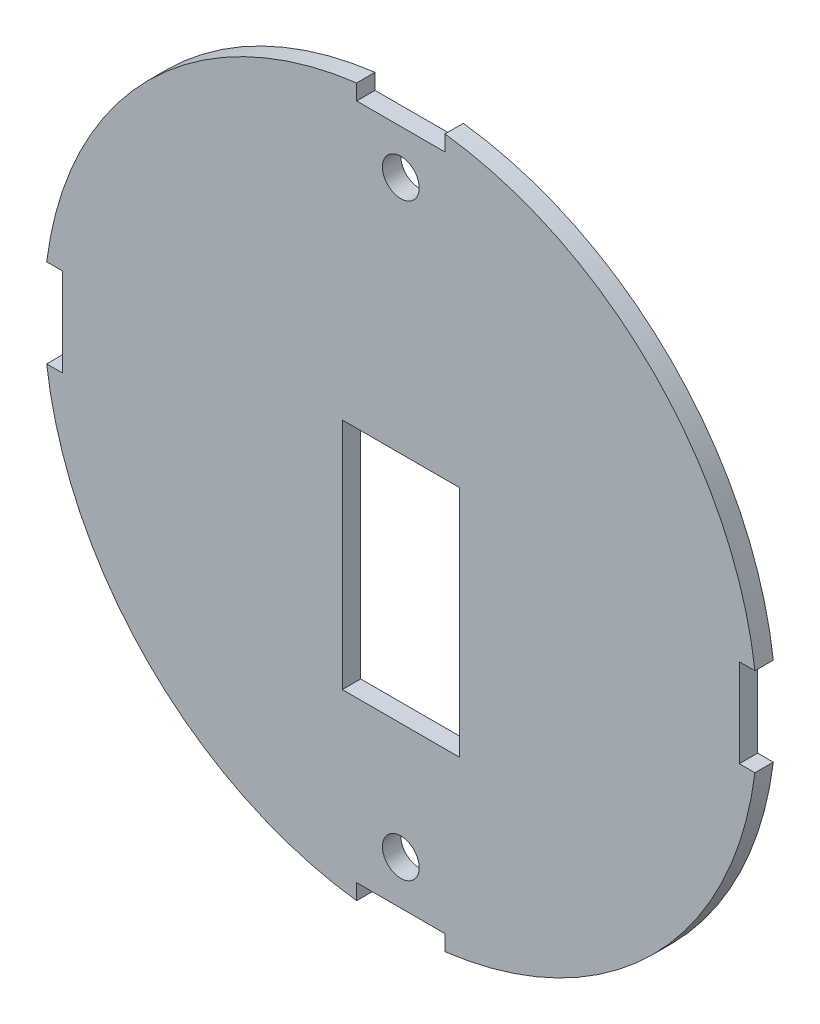
from build123d import *

# Parameters (mm, degrees)
SKETCH1_R           = 61.595
BOSS_EXTRUDE1_DEPTH = 3.175
SKETCH2_R           = 3.175
SKETCH2_W           = 15.24
SKETCH2_H           = 6.35
CUT_EXTRUDE1_DEPTH  = 3.175
CIRPATTERN1_COUNT   = 4
CUT_EXTRUDE2_DEPTH  = 3.175
BOSS_EXTRUDE2_START = -3.175
SKETCH5_R           = 3.175
BOSS_EXTRUDE2_DEPTH = 3.175


with BuildPart() as part:
    # Sketch1 → Boss-Extrude1 (new body)
    with BuildSketch(Plane.XY):
        Circle(SKETCH1_R)
    extrude(amount=BOSS_EXTRUDE1_DEPTH)

    # Sketch2 → Cut-Extrude1 (cut)
    with BuildSketch(Plane.XY.offset(3.175)):
        with Locations((0, 50.8)):
            Circle(SKETCH2_R)
        with Locations((0, 61.595)):
            Rectangle(SKETCH2_W, SKETCH2_H)
    cut_extrude1 = extrude(amount=-CUT_EXTRUDE1_DEPTH, mode=Mode.SUBTRACT)

    # CirPattern1: Cut-Extrude1 ×4 about axis
    cirpattern1_axis = Axis((0, 0, 3.175), (0, 0, 1))
    for i in range(1, CIRPATTERN1_COUNT):
        add(cut_extrude1.rotate(cirpattern1_axis, i * 360 / CIRPATTERN1_COUNT), mode=Mode.SUBTRACT)

    # Sketch3 → Cut-Extrude2 (cut)
    with BuildSketch(Plane.XY.offset(3.175)):
        Polygon((-10.1, 9.5), (-10.1, -29.8), (-10.1, -30.8), (-9.1, -30.8), (9.1, -30.8), (10.1, -30.8), (10.1, -29.8), (10.1, 8.5), (10.1, 9.5), align=None)
    extrude(amount=-CUT_EXTRUDE2_DEPTH, mode=Mode.SUBTRACT)

    # Sketch5 → Boss-Extrude2 (add)
    with BuildSketch(Plane(origin=(0, 0, 0), x_dir=(-1, 0, 0), z_dir=(0, 0, -1)).offset(BOSS_EXTRUDE2_START)):
        with Locations((-50.8, 0)):
            Circle(SKETCH5_R)
        with Locations((50.8, 0)):
            Circle(SKETCH5_R)
    extrude(amount=BOSS_EXTRUDE2_DEPTH)


solid = part.part
